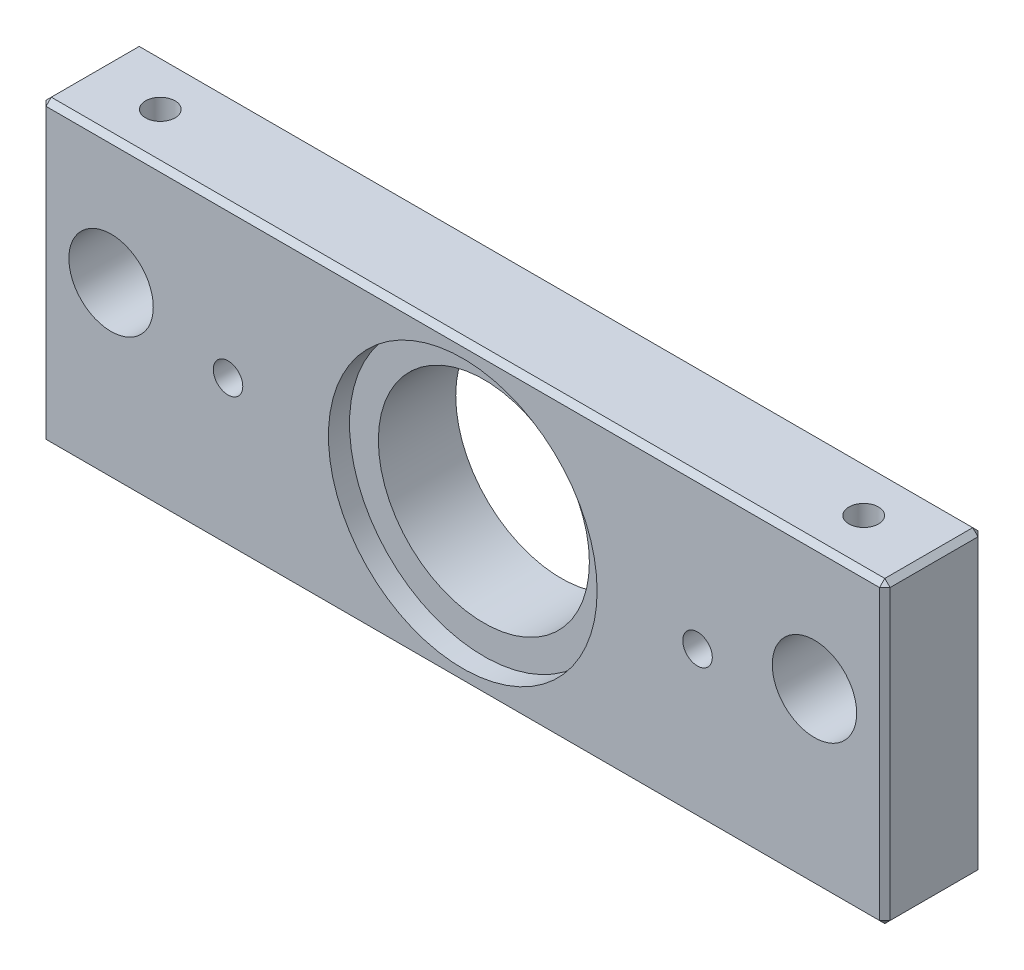
from build123d import *

# Parameters (mm, degrees)
SKETCH1_W           = 120
SKETCH1_H           = 42.5
BOSS_EXTRUDE1_DEPTH = 7
SKETCH2_R           = 19.1
CUT_EXTRUDE1_DEPTH  = 3
SKETCH3_R           = 15
CUT_EXTRUDE2_DEPTH  = 65.595375221
SKETCH4_R           = 2.1
CUT_EXTRUDE3_DEPTH  = 66.173326599
SKETCH5_R           = 6
CUT_EXTRUDE4_DEPTH  = 66.173326599
SKETCH6_R           = 2.1
SKETCH6_R_2         = 1.25
CUT_EXTRUDE5_DEPTH  = 10
CHAMFER1_SIZE       = 0.75
CUT_EXTRUDE6_REACH  = 75.86
SKETCH7_R           = 2.1


with BuildPart() as part:
    # Sketch1 → Boss-Extrude1 (new, symmetric)
    with BuildSketch(Plane.XY):
        Rectangle(SKETCH1_W, SKETCH1_H)
    extrude(amount=BOSS_EXTRUDE1_DEPTH, both=True)

    # Sketch2 → Cut-Extrude1 (cut)
    with BuildSketch(Plane.XY.offset(7)):
        Circle(SKETCH2_R)
    extrude(amount=-CUT_EXTRUDE1_DEPTH, mode=Mode.SUBTRACT)

    # Sketch3 → Cut-Extrude2 (cut, through all)
    with BuildSketch(Plane.XY.offset(4)):
        Circle(SKETCH3_R)
    extrude(amount=-CUT_EXTRUDE2_DEPTH, mode=Mode.SUBTRACT)

    # Sketch4 → Cut-Extrude3 (cut, through all)
    with BuildSketch(Plane.XY.offset(7)):
        with Locations((-33.375, 0)):
            Circle(SKETCH4_R)
        with Locations((33.375, 0)):
            Circle(SKETCH4_R)
    extrude(amount=-CUT_EXTRUDE3_DEPTH, mode=Mode.SUBTRACT)

    # Sketch5 → Cut-Extrude4 (cut, through all)
    with BuildSketch(Plane.XY.offset(7)):
        with Locations((-50, 3.4)):
            Circle(SKETCH5_R)
        with Locations((50, 3.4)):
            Circle(SKETCH5_R)
    extrude(amount=-CUT_EXTRUDE4_DEPTH, mode=Mode.SUBTRACT)

    # Sketch6 → Cut-Extrude5 (cut)
    with BuildSketch(Plane.XZ.offset(21.25)):
        with Locations((-50, 0)):
            Circle(SKETCH6_R)
        with Locations((-25, 0)):
            Circle(SKETCH6_R)
        with Locations((25, 0)):
            Circle(SKETCH6_R)
        with Locations((50, 0)):
            Circle(SKETCH6_R)
        with Locations((-37.5, 0)):
            Circle(SKETCH6_R_2)
        with Locations((37.5, 0)):
            Circle(SKETCH6_R_2)
    extrude(amount=-CUT_EXTRUDE5_DEPTH, mode=Mode.SUBTRACT)

    # Chamfer1
    chamfer1_edges = [part.edges().sort_by_distance(p)[0] for p in [
        (60, -21.25, 0),
        (60, 0, -7),
        (60, 21.25, 0),
        (0, -21.25, -7),
        (-60, -21.25, 0),
        (-60, 0, -7),
        (0, 21.25, -7),
        (-60, 21.25, 0),
        (60, 0, 7),
        (0, -21.25, 7),
        (-60, 0, 7),
        (0, 21.25, 7),
    ]]
    chamfer(chamfer1_edges, length=CHAMFER1_SIZE)

    # Sketch7 → Cut-Extrude6 (cut, up to next)
    with BuildSketch(Plane(origin=(0, 21.25, 0), x_dir=(1, 0, 0), z_dir=(0, 1, 0)), mode=Mode.PRIVATE) as cut_extrude6_sk1:
        with Locations((-50, 0)):
            Circle(SKETCH7_R)
    cut_extrude6_tool1 = extrude(cut_extrude6_sk1.sketch, amount=-CUT_EXTRUDE6_REACH, mode=Mode.PRIVATE) & part.part
    # Sketch7 → Cut-Extrude6 (cut, up to next)
    with BuildSketch(Plane(origin=(0, 21.25, 0), x_dir=(1, 0, 0), z_dir=(0, 1, 0)), mode=Mode.PRIVATE) as cut_extrude6_sk2:
        with Locations((50, 0)):
            Circle(SKETCH7_R)
    cut_extrude6_tool2 = extrude(cut_extrude6_sk2.sketch, amount=-CUT_EXTRUDE6_REACH, mode=Mode.PRIVATE) & part.part
    add(cut_extrude6_tool1.solids().sort_by_distance((-50, 21.25, 0))[0], mode=Mode.SUBTRACT)
    add(cut_extrude6_tool2.solids().sort_by_distance((50, 21.25, 0))[0], mode=Mode.SUBTRACT)


solid = part.part
